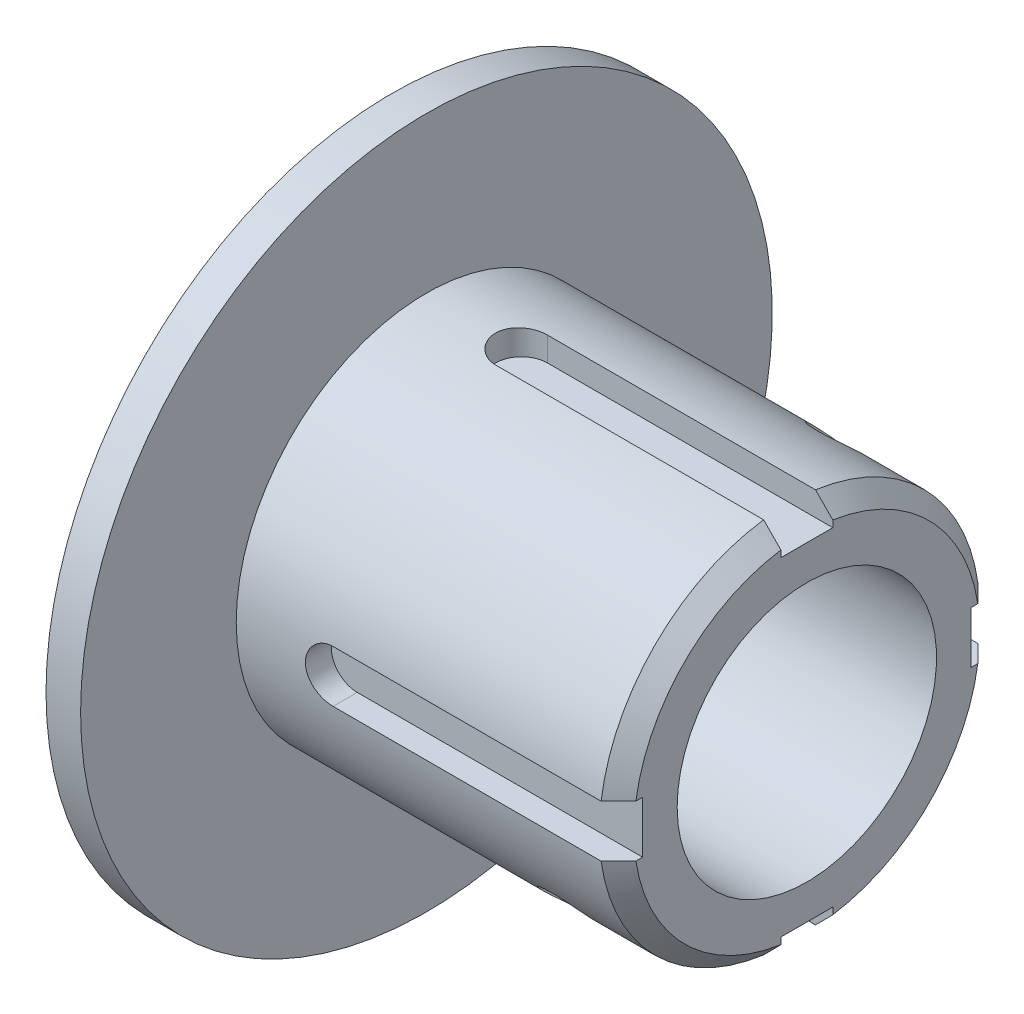
from build123d import *

# Parameters (mm, degrees)
ENL_V_MAT_EXTRU_1_DEPTH      = 3
R_P_TITION_CIRCULAIRE1_COUNT = 4
ESQUISSE5_R                  = 3
ENL_V_MAT_EXTRU_2_DEPTH      = 40


with BuildPart() as part:
    # Esquisse1 → Base-Révolution (revolve)
    with BuildSketch(Plane.XY):
        Polygon((0, 40), (-4, 40), (-10, 23.515135483), (-10, 15), (44, 15), (44, 20), (42, 22), (0, 22), align=None)
    revolve(axis=Axis((0, 0, 0), (1, 0, 0)))

    # Esquisse3 → Enlèv. mat.-Extru.1 (cut)
    with BuildSketch(Plane(origin=(21, 22, 0), x_dir=(0, 0, -1), z_dir=(0, 1, 0))):
        with BuildLine():
            Line((-3, -25), (3, -25))
            Line((3, -25), (3, 10))
            ThreePointArc((3, 10), (0, 13), (-3, 10))
            Line((-3, 10), (-3, -25))
        make_face()
    enl_v_mat_extru_1 = extrude(amount=-ENL_V_MAT_EXTRU_1_DEPTH, mode=Mode.SUBTRACT)

    # Répétition circulaire1: Enlèv. mat.-Extru.1 ×4 about axis
    r_p_tition_circulaire1_axis = Axis((0, 0, 0), (1, 0, 0))
    for i in range(1, R_P_TITION_CIRCULAIRE1_COUNT):
        add(enl_v_mat_extru_1.rotate(r_p_tition_circulaire1_axis, i * 360 / R_P_TITION_CIRCULAIRE1_COUNT), mode=Mode.SUBTRACT)

    # Esquisse5 → Enlèv. mat.-Extru.2 (cut, symmetric)
    with BuildSketch(Plane(origin=(0, 0, 0), x_dir=(1, 0, 0), z_dir=(0, -0.7071067811865488, 0.7071067811865462))):
        with Locations((32, 0)):
            Circle(ESQUISSE5_R)
    extrude(amount=ENL_V_MAT_EXTRU_2_DEPTH, both=True, mode=Mode.SUBTRACT)


solid = part.part
